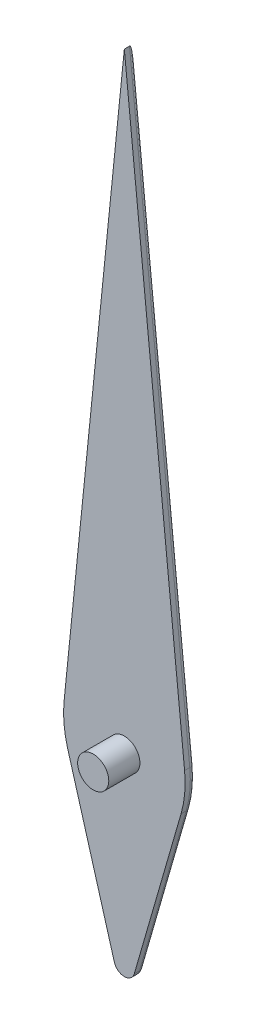
from build123d import *

# Parameters (mm, degrees)
EXTRUDE_1_DEPTH     = 0.1
SKETCH_2_R          = 0.15
EXTRUDE_2_DEPTH     = 0.3
FILLET_1_R          = 0.1
FILLET_3_R          = 0.05
SKETCH_3_R          = 0.15
CUT_EXTRUDE_1_DEPTH = 0.05
FILLET_4_R          = 0.05


with BuildPart() as part:
    # Эскиз1 → Бобышка-Вытянуть1 (new body)
    with BuildSketch(Plane.XY):
        with BuildLine():
            Line((0, 8), (-0.580504166, 2.26976061))
            ThreePointArc((-0.580504166, 2.26976061), (-0.58153919, 2.078982478), (-0.546324519, 1.891479695))
            Line((-0.546324519, 1.891479695), (0, 0))
            Line((0, 0), (0.546324519, 1.891479695))
            ThreePointArc((0.546324519, 1.891479695), (0.58153919, 2.078982478), (0.580504166, 2.26976061))
            Line((0.580504166, 2.26976061), (0, 8))
        make_face()
    extrude(amount=EXTRUDE_1_DEPTH)

    # Эскиз2 → Бобышка-Вытянуть2 (add)
    with BuildSketch(Plane.XY.offset(0.1)):
        with Locations((0, 2.117926147)):
            Circle(SKETCH_2_R)
    extrude(amount=EXTRUDE_2_DEPTH)

    # Скругление1
    fillet_1_edges = [part.edges().sort_by_distance(p)[0] for p in [
        (0, 0, 0.05),
    ]]
    fillet(fillet_1_edges, radius=FILLET_1_R)

    # Скругление3
    fillet_3_edges = [part.edges().sort_by_distance(p)[0] for p in [
        (0.321198666, 1.112051048, 0),
        (0, 0.260371541, 0),
        (-0.321198666, 1.112051048, 0),
        (-0.58153919, 2.078982478, 0),
        (-0.290252083, 5.134880305, 0),
        (0.290252083, 5.134880305, 0),
        (0.58153919, 2.078982478, 0),
    ]]
    fillet(fillet_3_edges, radius=FILLET_3_R)

    # Эскиз3 → Вырез-Вытянуть1 (cut)
    with BuildSketch(Plane(origin=(0, 0, 0), x_dir=(-1, 0, 0), z_dir=(0, 0, -1))):
        with Locations(Location((0, 2.117926147, 0), (0, 0, 180))):
            Circle(SKETCH_3_R)
    extrude(amount=-CUT_EXTRUDE_1_DEPTH, mode=Mode.SUBTRACT)

    # Скругление4
    fillet_4_edges = [part.edges().sort_by_distance(p)[0] for p in [
        (-0.15, 2.117926147, 0),
    ]]
    fillet(fillet_4_edges, radius=FILLET_4_R - 0.0001)  # a hair under: the kernel refuses the full size


solid = part.part
